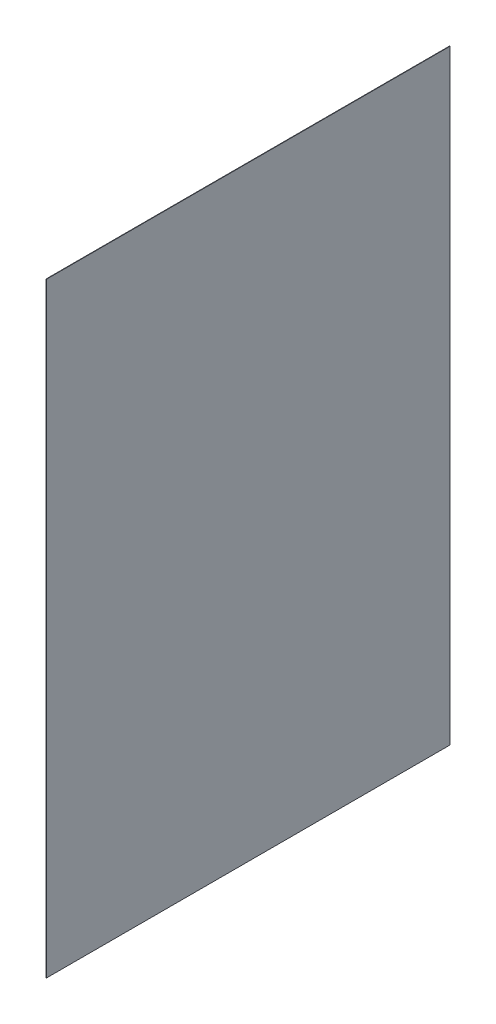
from build123d import *

# Parameters (mm, degrees)
SKETCH1_W          = 659
SKETCH1_H          = 988.4
BASE_FLANGE1_DEPTH = 0.7


# Sheet-metal steps are written as plain solids
with BuildPart() as part:
    # Sketch1 → Base-Flange1 (new body)
    with BuildSketch(Plane(origin=(0, 0, 0), x_dir=(0, 0, -1), z_dir=(1, 0, 0))):
        with Locations((329.5, 494.2)):
            Rectangle(SKETCH1_W, SKETCH1_H)
    extrude(amount=-BASE_FLANGE1_DEPTH)


solid = part.part
